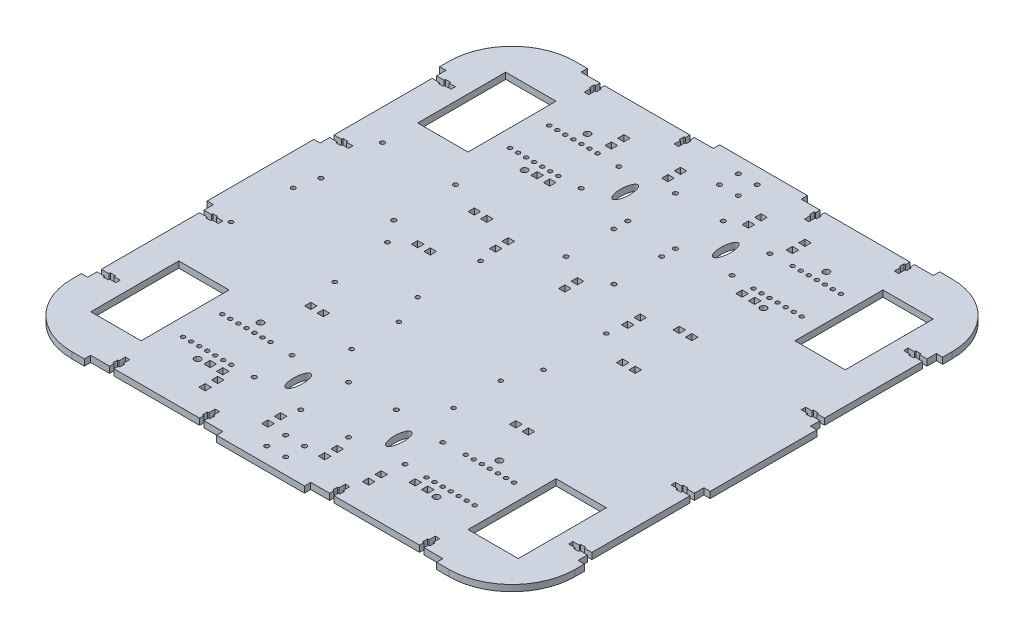
from build123d import *

# Parameters (mm, degrees)
SKETCH1_W           = 400
SKETCH1_H           = 400
SKETCH1_R           = 1.75
SKETCH1_W_2         = 40
SKETCH1_H_2         = 70
BOSS_EXTRUDE2_DEPTH = 5
FILLET1_R           = 50
SKETCH2_R           = 1.6
CUT_EXTRUDE1_DEPTH  = 5
SKETCH3_R           = 1.65
CUT_EXTRUDE2_DEPTH  = 10
SKETCH4_R           = 1.75
CUT_EXTRUDE3_DEPTH  = 10
SKETCH5_R           = 1.75
CUT_EXTRUDE4_DEPTH  = 10
SKETCH6_RX          = 10
SKETCH6_RY          = 3.75
CUT_EXTRUDE5_DEPTH  = 10
SKETCH7_R           = 1.65
CUT_EXTRUDE6_DEPTH  = 10
SKETCH8_R           = 1.65
CUT_EXTRUDE7_DEPTH  = 5
CUT_EXTRUDE8_DEPTH  = 10
SKETCH11_W          = 105.1
SKETCH11_H          = 5
CUT_EXTRUDE9_DEPTH  = 10
CUT_EXTRUDE10_DEPTH = 5
SKETCH13_W          = 5
SKETCH13_H          = 100.1
CUT_EXTRUDE11_DEPTH = 5
SKETCH14_W          = 5
SKETCH14_H          = 5
CUT_EXTRUDE12_DEPTH = 10
SKETCH15_R          = 2.5
CUT_EXTRUDE13_DEPTH = 10
SKETCH16_R          = 1.75
CUT_EXTRUDE14_DEPTH = 10


with BuildPart() as part:
    # Sketch1 → Boss-Extrude2 (new body)
    with BuildSketch(Plane(origin=(0, 0, 0), x_dir=(1, 0, 0), z_dir=(0, 1, 0))):
        Rectangle(SKETCH1_W, SKETCH1_H)
        with Locations((-7.5, 172.5)):
            Circle(SKETCH1_R, mode=Mode.SUBTRACT)
        with Locations((-7.5, 187.5)):
            Circle(SKETCH1_R, mode=Mode.SUBTRACT)
        with Locations((7.5, 172.5)):
            Circle(SKETCH1_R, mode=Mode.SUBTRACT)
        with Locations((7.5, 187.5)):
            Circle(SKETCH1_R, mode=Mode.SUBTRACT)
        with Locations((-150, -130)):
            Rectangle(SKETCH1_W_2, SKETCH1_H_2, mode=Mode.SUBTRACT)
        with Locations((150, -130)):
            Rectangle(SKETCH1_W_2, SKETCH1_H_2, mode=Mode.SUBTRACT)
        with Locations((-150, 130)):
            Rectangle(SKETCH1_W_2, SKETCH1_H_2, mode=Mode.SUBTRACT)
        with Locations((150, 130)):
            Rectangle(SKETCH1_W_2, SKETCH1_H_2, mode=Mode.SUBTRACT)
        with Locations((-7.5, -187.5)):
            Circle(SKETCH1_R, mode=Mode.SUBTRACT)
        with Locations((-7.5, -172.5)):
            Circle(SKETCH1_R, mode=Mode.SUBTRACT)
        with Locations((7.5, -187.5)):
            Circle(SKETCH1_R, mode=Mode.SUBTRACT)
        with Locations((7.5, -172.5)):
            Circle(SKETCH1_R, mode=Mode.SUBTRACT)
    extrude(amount=BOSS_EXTRUDE2_DEPTH)

    # Fillet1
    fillet1_edges = [part.edges().sort_by_distance(p)[0] for p in [
        (200, 2.5, -200),
        (200, 2.5, 200),
        (-200, 2.5, 200),
        (-200, 2.5, -200),
    ]]
    fillet(fillet1_edges, radius=FILLET1_R)

    # Sketch2 → Cut-Extrude1 (cut)
    with BuildSketch(Plane(origin=(0, 5, 0), x_dir=(1, 0, 0), z_dir=(0, 1, 0))):
        with Locations((-116, 145.6)):
            Circle(SKETCH2_R)
        with Locations((-109.6, 145.6)):
            Circle(SKETCH2_R)
        with Locations((-103.2, 145.6)):
            Circle(SKETCH2_R)
        with Locations((-96.8, 145.6)):
            Circle(SKETCH2_R)
        with Locations((-90.4, 145.6)):
            Circle(SKETCH2_R)
        with Locations((-84, 145.6)):
            Circle(SKETCH2_R)
        with Locations((-77.6, 145.6)):
            Circle(SKETCH2_R)
        with Locations((-77.6, 114.4)):
            Circle(SKETCH2_R)
        with Locations((-84, 114.4)):
            Circle(SKETCH2_R)
        with Locations((-90.4, 114.4)):
            Circle(SKETCH2_R)
        with Locations((-96.8, 114.4)):
            Circle(SKETCH2_R)
        with Locations((-103.2, 114.4)):
            Circle(SKETCH2_R)
        with Locations((-109.6, 114.4)):
            Circle(SKETCH2_R)
        with Locations((-116, 114.4)):
            Circle(SKETCH2_R)
        with Locations((77.6, 114.4)):
            Circle(SKETCH2_R)
        with Locations((84, 114.4)):
            Circle(SKETCH2_R)
        with Locations((90.4, 114.4)):
            Circle(SKETCH2_R)
        with Locations((96.8, 114.4)):
            Circle(SKETCH2_R)
        with Locations((103.2, 114.4)):
            Circle(SKETCH2_R)
        with Locations((109.6, 114.4)):
            Circle(SKETCH2_R)
        with Locations((116, 114.4)):
            Circle(SKETCH2_R)
        with Locations((77.6, 145.6)):
            Circle(SKETCH2_R)
        with Locations((84, 145.6)):
            Circle(SKETCH2_R)
        with Locations((90.4, 145.6)):
            Circle(SKETCH2_R)
        with Locations((96.8, 145.6)):
            Circle(SKETCH2_R)
        with Locations((103.2, 145.6)):
            Circle(SKETCH2_R)
        with Locations((109.6, 145.6)):
            Circle(SKETCH2_R)
        with Locations((116, 145.6)):
            Circle(SKETCH2_R)
        with Locations((116, -145.6)):
            Circle(SKETCH2_R)
        with Locations((109.6, -145.6)):
            Circle(SKETCH2_R)
        with Locations((103.2, -145.6)):
            Circle(SKETCH2_R)
        with Locations((96.8, -145.6)):
            Circle(SKETCH2_R)
        with Locations((90.4, -145.6)):
            Circle(SKETCH2_R)
        with Locations((84, -145.6)):
            Circle(SKETCH2_R)
        with Locations((77.6, -145.6)):
            Circle(SKETCH2_R)
        with Locations((116, -114.4)):
            Circle(SKETCH2_R)
        with Locations((109.6, -114.4)):
            Circle(SKETCH2_R)
        with Locations((103.2, -114.4)):
            Circle(SKETCH2_R)
        with Locations((96.8, -114.4)):
            Circle(SKETCH2_R)
        with Locations((90.4, -114.4)):
            Circle(SKETCH2_R)
        with Locations((84, -114.4)):
            Circle(SKETCH2_R)
        with Locations((77.6, -114.4)):
            Circle(SKETCH2_R)
        with Locations((-116, -114.4)):
            Circle(SKETCH2_R)
        with Locations((-109.6, -114.4)):
            Circle(SKETCH2_R)
        with Locations((-103.2, -114.4)):
            Circle(SKETCH2_R)
        with Locations((-96.8, -114.4)):
            Circle(SKETCH2_R)
        with Locations((-90.4, -114.4)):
            Circle(SKETCH2_R)
        with Locations((-84, -114.4)):
            Circle(SKETCH2_R)
        with Locations((-77.6, -114.4)):
            Circle(SKETCH2_R)
        with Locations((-77.6, -145.6)):
            Circle(SKETCH2_R)
        with Locations((-84, -145.6)):
            Circle(SKETCH2_R)
        with Locations((-90.4, -145.6)):
            Circle(SKETCH2_R)
        with Locations((-96.8, -145.6)):
            Circle(SKETCH2_R)
        with Locations((-103.2, -145.6)):
            Circle(SKETCH2_R)
        with Locations((-109.6, -145.6)):
            Circle(SKETCH2_R)
        with Locations((-116, -145.6)):
            Circle(SKETCH2_R)
    extrude(amount=-CUT_EXTRUDE1_DEPTH, mode=Mode.SUBTRACT)

    # Sketch3 → Cut-Extrude2 (cut)
    with BuildSketch(Plane(origin=(0, 5, 0), x_dir=(1, 0, 0), z_dir=(0, 1, 0))):
        with Locations((-176.03, -47.46)):
            Circle(SKETCH3_R)
        with Locations((-174.76, 0.8)):
            Circle(SKETCH3_R)
        with Locations((-93.48, -47.46)):
            Circle(SKETCH3_R)
        with Locations((-99.83, 0.8)):
            Circle(SKETCH3_R)
    extrude(amount=-CUT_EXTRUDE2_DEPTH, mode=Mode.SUBTRACT)

    # Sketch4 → Cut-Extrude3 (cut)
    with BuildSketch(Plane(origin=(0, 5, 0), x_dir=(1, 0, 0), z_dir=(0, 1, 0))):
        with Locations((-19, 149)):
            Circle(SKETCH4_R)
        with Locations((19, 149)):
            Circle(SKETCH4_R)
        with Locations((19, 111)):
            Circle(SKETCH4_R)
        with Locations((-19, 111)):
            Circle(SKETCH4_R)
        with Locations((-19, 100)):
            Circle(SKETCH4_R)
        with Locations((19, 100)):
            Circle(SKETCH4_R)
        with Locations((19, 62)):
            Circle(SKETCH4_R)
        with Locations((-19, 62)):
            Circle(SKETCH4_R)
        with Locations((-19, -149)):
            Circle(SKETCH4_R)
        with Locations((19, -149)):
            Circle(SKETCH4_R)
        with Locations((-19, -111)):
            Circle(SKETCH4_R)
        with Locations((19, -111)):
            Circle(SKETCH4_R)
    extrude(amount=-CUT_EXTRUDE3_DEPTH, mode=Mode.SUBTRACT)

    # Sketch5 → Cut-Extrude4 (cut)
    with BuildSketch(Plane(origin=(0, 5, 0), x_dir=(1, 0, 0), z_dir=(0, 1, 0))):
        with Locations((-170.5, 67.5)):
            Circle(SKETCH5_R)
        with Locations((-112.5, 67.5)):
            Circle(SKETCH5_R)
        with Locations((-112.5, 18.5)):
            Circle(SKETCH5_R)
        with Locations((-170.5, 18.5)):
            Circle(SKETCH5_R)
    extrude(amount=-CUT_EXTRUDE4_DEPTH, mode=Mode.SUBTRACT)

    # Sketch6 → Cut-Extrude5 (cut)
    with BuildSketch(Plane(origin=(0, 5, 0), x_dir=(1, 0, 0), z_dir=(0, 1, 0))):
        with Locations(Location((-40, 130), (0, 0, 90))):
            Ellipse(SKETCH6_RX, SKETCH6_RY)
        with Locations(Location((40, 130), (0, 0, 90))):
            Ellipse(SKETCH6_RX, SKETCH6_RY)
        with Locations(Location((40, -130), (0, 0, -90))):
            Ellipse(SKETCH6_RX, SKETCH6_RY)
        with Locations(Location((-40, -130), (0, 0, -90))):
            Ellipse(SKETCH6_RX, SKETCH6_RY)
    extrude(amount=-CUT_EXTRUDE5_DEPTH, mode=Mode.SUBTRACT)

    # Sketch7 → Cut-Extrude6 (cut)
    with BuildSketch(Plane(origin=(0, 5, 0), x_dir=(1, 0, 0), z_dir=(0, 1, 0))):
        with Locations((-50, 25)):
            Circle(SKETCH7_R)
        with Locations((50, 25)):
            Circle(SKETCH7_R)
        with Locations((50, -25)):
            Circle(SKETCH7_R)
        with Locations((-50, -25)):
            Circle(SKETCH7_R)
    extrude(amount=-CUT_EXTRUDE6_DEPTH, mode=Mode.SUBTRACT)

    # Sketch8 → Cut-Extrude7 (cut)
    with BuildSketch(Plane(origin=(0, 5, 0), x_dir=(1, 0, 0), z_dir=(0, 1, 0))):
        with Locations((-40.5, -49.5)):
            Circle(SKETCH8_R)
        with Locations((40.5, -49.5)):
            Circle(SKETCH8_R)
        with Locations((40.5, -87)):
            Circle(SKETCH8_R)
        with Locations((-40.5, -87)):
            Circle(SKETCH8_R)
    extrude(amount=-CUT_EXTRUDE7_DEPTH, mode=Mode.SUBTRACT)

    # Sketch10 → Cut-Extrude8 (cut)
    with BuildSketch(Plane(origin=(0, 5, 0), x_dir=(1, 0, 0), z_dir=(0, 1, 0))):
        Polygon((-125, -200), (-121.5, -200), (-121.5, -191.5), (-120.4, -191.5), (-120.4, -187.5), (-121.5, -187.5), (-121.5, -182.5), (-125, -182.5), (-125, -187.5), (-126.1, -187.5), (-126.1, -191.5), (-125, -191.5), align=None)
        Polygon((-53.5, -200), (-50, -200), (-50, -191.5), (-48.9, -191.5), (-48.9, -187.5), (-50, -187.5), (-50, -182.5), (-53.5, -182.5), (-53.5, -187.5), (-54.6, -187.5), (-54.6, -191.5), (-53.5, -191.5), align=None)
        Polygon((125, -200), (125, -191.5), (126.1, -191.5), (126.1, -187.5), (125, -187.5), (125, -182.5), (121.5, -182.5), (121.5, -187.5), (120.4, -187.5), (120.4, -191.5), (121.5, -191.5), (121.5, -200), align=None)
        Polygon((53.5, -200), (53.5, -191.5), (54.6, -191.5), (54.6, -187.5), (53.5, -187.5), (53.5, -182.5), (50, -182.5), (50, -187.5), (48.9, -187.5), (48.9, -191.5), (50, -191.5), (50, -200), align=None)
        Polygon((125, 200), (121.5, 200), (121.5, 191.5), (120.4, 191.5), (120.4, 187.5), (121.5, 187.5), (121.5, 182.5), (125, 182.5), (125, 187.5), (126.1, 187.5), (126.1, 191.5), (125, 191.5), align=None)
        Polygon((53.5, 200), (50, 200), (50, 191.5), (48.9, 191.5), (48.9, 187.5), (50, 187.5), (50, 182.5), (53.5, 182.5), (53.5, 187.5), (54.6, 187.5), (54.6, 191.5), (53.5, 191.5), align=None)
        Polygon((-53.5, 200), (-53.5, 191.5), (-54.6, 191.5), (-54.6, 187.5), (-53.5, 187.5), (-53.5, 182.5), (-50, 182.5), (-50, 187.5), (-48.9, 187.5), (-48.9, 191.5), (-50, 191.5), (-50, 200), align=None)
        Polygon((-125, 200), (-125, 191.5), (-126.1, 191.5), (-126.1, 187.5), (-125, 187.5), (-125, 182.5), (-121.5, 182.5), (-121.5, 187.5), (-120.4, 187.5), (-120.4, 191.5), (-121.5, 191.5), (-121.5, 200), align=None)
    extrude(amount=-CUT_EXTRUDE8_DEPTH, mode=Mode.SUBTRACT)

    # Sketch11 → Cut-Extrude9 (cut)
    with BuildSketch(Plane(origin=(0, 5, 0), x_dir=(1, 0, 0), z_dir=(0, 1, 0))):
        with Locations((-87.5, -197.5)):
            Rectangle(SKETCH11_W, SKETCH11_H)
        with Locations((87.5, -197.5)):
            Rectangle(SKETCH11_W, SKETCH11_H)
        with Locations((87.5, 197.5)):
            Rectangle(SKETCH11_W, SKETCH11_H)
        with Locations((-87.5, 197.5)):
            Rectangle(SKETCH11_W, SKETCH11_H)
    extrude(amount=-CUT_EXTRUDE9_DEPTH, mode=Mode.SUBTRACT)

    # Sketch12 → Cut-Extrude10 (cut)
    with BuildSketch(Plane(origin=(0, 5, 0), x_dir=(1, 0, 0), z_dir=(0, 1, 0))):
        Polygon((-200, 135), (-189, 135), (-189, 136.1), (-185, 136.1), (-185, 135), (-180, 135), (-180, 131.5), (-185, 131.5), (-185, 130.4), (-189, 130.4), (-189, 131.5), (-200, 131.5), align=None)
        Polygon((-200, 53.5), (-189, 53.5), (-189, 54.6), (-185, 54.6), (-185, 53.5), (-180, 53.5), (-180, 50), (-185, 50), (-185, 48.9), (-189, 48.9), (-189, 50), (-200, 50), align=None)
        Polygon((-200, -53.5), (-200, -50), (-189, -50), (-189, -48.9), (-185, -48.9), (-185, -50), (-180, -50), (-180, -53.5), (-185, -53.5), (-185, -54.6), (-189, -54.6), (-189, -53.5), align=None)
        Polygon((-200, -135), (-200, -131.5), (-189, -131.5), (-189, -130.4), (-185, -130.4), (-185, -131.5), (-180, -131.5), (-180, -135), (-185, -135), (-185, -136.1), (-189, -136.1), (-189, -135), align=None)
        Polygon((200, -135), (189, -135), (189, -136.1), (185, -136.1), (185, -135), (180, -135), (180, -131.5), (185, -131.5), (185, -130.4), (189, -130.4), (189, -131.5), (200, -131.5), align=None)
        Polygon((200, -53.5), (189, -53.5), (189, -54.6), (185, -54.6), (185, -53.5), (180, -53.5), (180, -50), (185, -50), (185, -48.9), (189, -48.9), (189, -50), (200, -50), align=None)
        Polygon((200, 53.5), (200, 50), (189, 50), (189, 48.9), (185, 48.9), (185, 50), (180, 50), (180, 53.5), (185, 53.5), (185, 54.6), (189, 54.6), (189, 53.5), align=None)
        Polygon((200, 135), (200, 131.5), (189, 131.5), (189, 130.4), (185, 130.4), (185, 131.5), (180, 131.5), (180, 135), (185, 135), (185, 136.1), (189, 136.1), (189, 135), align=None)
    extrude(amount=-CUT_EXTRUDE10_DEPTH, mode=Mode.SUBTRACT)

    # Sketch13 → Cut-Extrude11 (cut)
    with BuildSketch(Plane(origin=(0, 5, 0), x_dir=(1, 0, 0), z_dir=(0, 1, 0))):
        with Locations((-197.5, 92.45)):
            Rectangle(SKETCH13_W, SKETCH13_H)
        with Locations((-197.5, -92.45)):
            Rectangle(SKETCH13_W, SKETCH13_H)
        with Locations((197.5, -92.45)):
            Rectangle(SKETCH13_W, SKETCH13_H)
        with Locations((197.5, 92.45)):
            Rectangle(SKETCH13_W, SKETCH13_H)
    extrude(amount=-CUT_EXTRUDE11_DEPTH, mode=Mode.SUBTRACT)

    # Sketch14 → Cut-Extrude12 (cut)
    with BuildSketch(Plane(origin=(0, 5, 0), x_dir=(1, 0, 0), z_dir=(0, 1, 0))):
        with Locations((31.5, 166.5)):
            Rectangle(SKETCH14_W, SKETCH14_H)
        with Locations((31.5, 156.5)):
            Rectangle(SKETCH14_W, SKETCH14_H)
        with Locations((66.5, 166.5)):
            Rectangle(SKETCH14_W, SKETCH14_H)
        with Locations((66.5, 156.5)):
            Rectangle(SKETCH14_W, SKETCH14_H)
        with Locations((2.5, 49.5)):
            Rectangle(SKETCH14_W, SKETCH14_H)
        with Locations((2.5, 39.5)):
            Rectangle(SKETCH14_W, SKETCH14_H)
        with Locations((52.5, 49.5)):
            Rectangle(SKETCH14_W, SKETCH14_H)
        with Locations((52.5, 39.5)):
            Rectangle(SKETCH14_W, SKETCH14_H)
        with Locations((22.5, -161.5)):
            Rectangle(SKETCH14_W, SKETCH14_H)
        with Locations((22.5, -171.5)):
            Rectangle(SKETCH14_W, SKETCH14_H)
        with Locations((57.5, -161.5)):
            Rectangle(SKETCH14_W, SKETCH14_H)
        with Locations((57.5, -171.5)):
            Rectangle(SKETCH14_W, SKETCH14_H)
        with Locations((-32.5, 166.5)):
            Rectangle(SKETCH14_W, SKETCH14_H)
        with Locations((-32.5, 156.5)):
            Rectangle(SKETCH14_W, SKETCH14_H)
        with Locations((-52.5, 49.5)):
            Rectangle(SKETCH14_W, SKETCH14_H)
        with Locations((-52.5, 39.5)):
            Rectangle(SKETCH14_W, SKETCH14_H)
        with Locations((-22.5, -161.5)):
            Rectangle(SKETCH14_W, SKETCH14_H)
        with Locations((-22.5, -171.5)):
            Rectangle(SKETCH14_W, SKETCH14_H)
        with Locations((-77.5, 166.5)):
            Rectangle(SKETCH14_W, SKETCH14_H)
        with Locations((-77.5, 156.5)):
            Rectangle(SKETCH14_W, SKETCH14_H)
        with Locations((-72.5, -161.5)):
            Rectangle(SKETCH14_W, SKETCH14_H)
        with Locations((-72.5, -171.5)):
            Rectangle(SKETCH14_W, SKETCH14_H)
        with Locations((76.5, -153.5)):
            Rectangle(SKETCH14_W, SKETCH14_H)
        with Locations((86.5, -153.5)):
            Rectangle(SKETCH14_W, SKETCH14_H)
        with Locations((76.5, -73.5)):
            Rectangle(SKETCH14_W, SKETCH14_H)
        with Locations((86.5, -73.5)):
            Rectangle(SKETCH14_W, SKETCH14_H)
        with Locations((76.5, 11.5)):
            Rectangle(SKETCH14_W, SKETCH14_H)
        with Locations((86.5, 11.5)):
            Rectangle(SKETCH14_W, SKETCH14_H)
        with Locations((76.5, 56.5)):
            Rectangle(SKETCH14_W, SKETCH14_H)
        with Locations((86.5, 56.5)):
            Rectangle(SKETCH14_W, SKETCH14_H)
        with Locations((76.5, 106.5)):
            Rectangle(SKETCH14_W, SKETCH14_H)
        with Locations((86.5, 106.5)):
            Rectangle(SKETCH14_W, SKETCH14_H)
        with Locations((-76.5, 106.5)):
            Rectangle(SKETCH14_W, SKETCH14_H)
        with Locations((-86.5, 106.5)):
            Rectangle(SKETCH14_W, SKETCH14_H)
        with Locations((-76.5, 56.5)):
            Rectangle(SKETCH14_W, SKETCH14_H)
        with Locations((-86.5, 56.5)):
            Rectangle(SKETCH14_W, SKETCH14_H)
        with Locations((-76.5, 11.5)):
            Rectangle(SKETCH14_W, SKETCH14_H)
        with Locations((-86.5, 11.5)):
            Rectangle(SKETCH14_W, SKETCH14_H)
        with Locations((-76.5, -73.5)):
            Rectangle(SKETCH14_W, SKETCH14_H)
        with Locations((-86.5, -73.5)):
            Rectangle(SKETCH14_W, SKETCH14_H)
        with Locations((-76.5, -153.5)):
            Rectangle(SKETCH14_W, SKETCH14_H)
        with Locations((-86.5, -153.5)):
            Rectangle(SKETCH14_W, SKETCH14_H)
    extrude(amount=-CUT_EXTRUDE12_DEPTH, mode=Mode.SUBTRACT)

    # Sketch15 → Cut-Extrude13 (cut)
    with BuildSketch(Plane(origin=(0, 5, 0), x_dir=(1, 0, 0), z_dir=(0, 1, 0))):
        with Locations((-95, 105)):
            Circle(SKETCH15_R)
        with Locations((-95, 155)):
            Circle(SKETCH15_R)
        with Locations((95, 155)):
            Circle(SKETCH15_R)
        with Locations((95, 105)):
            Circle(SKETCH15_R)
        with Locations((95, -105)):
            Circle(SKETCH15_R)
        with Locations((95, -155)):
            Circle(SKETCH15_R)
        with Locations((-95, -155)):
            Circle(SKETCH15_R)
        with Locations((-95, -105)):
            Circle(SKETCH15_R)
    extrude(amount=-CUT_EXTRUDE13_DEPTH, mode=Mode.SUBTRACT)

    # Sketch16 → Cut-Extrude14 (cut)
    with BuildSketch(Plane(origin=(0, 5, 0), x_dir=(1, 0, 0), z_dir=(0, 1, 0))):
        with Locations((-60, 145)):
            Circle(SKETCH16_R)
        with Locations((-60, 115)):
            Circle(SKETCH16_R)
        with Locations((60, 115)):
            Circle(SKETCH16_R)
        with Locations((60, 145)):
            Circle(SKETCH16_R)
        with Locations((60, -115)):
            Circle(SKETCH16_R)
        with Locations((60, -145)):
            Circle(SKETCH16_R)
        with Locations((-60, -145)):
            Circle(SKETCH16_R)
        with Locations((-60, -115)):
            Circle(SKETCH16_R)
    extrude(amount=-CUT_EXTRUDE14_DEPTH, mode=Mode.SUBTRACT)


solid = part.part
